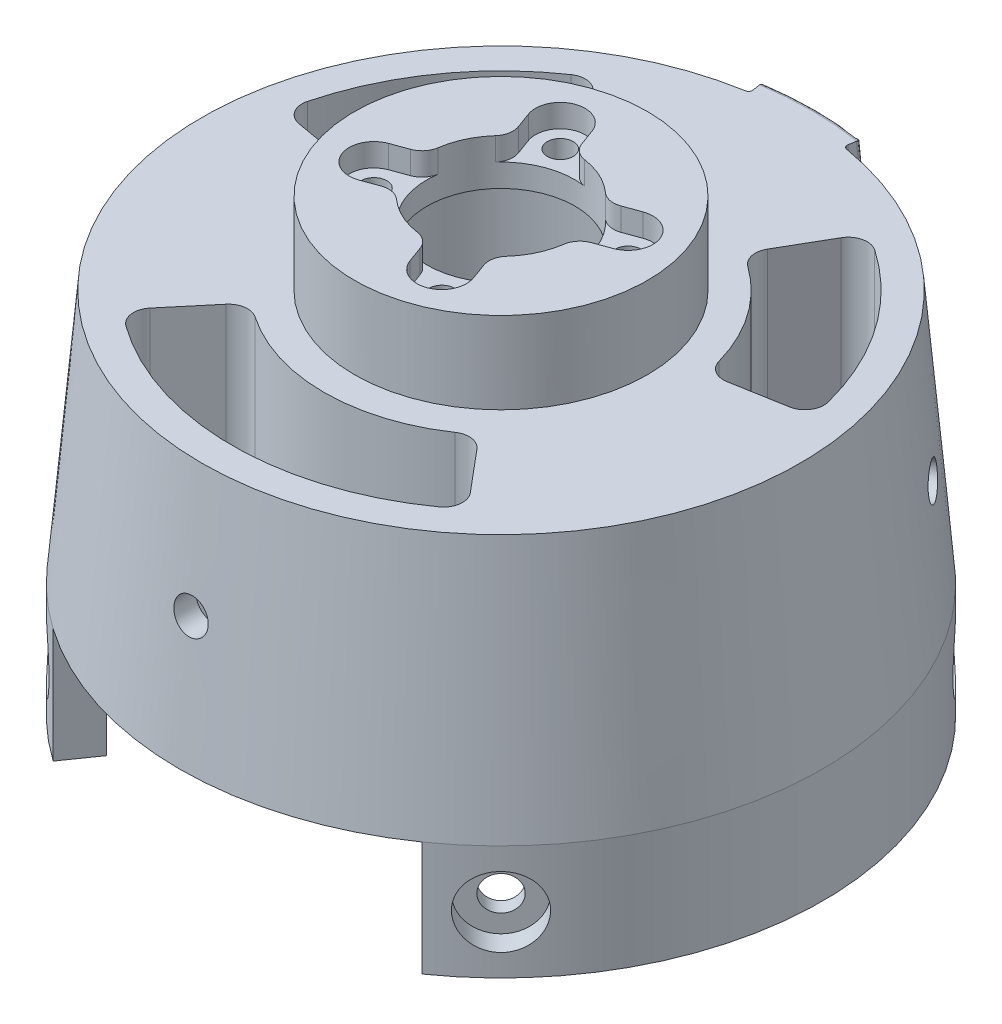
from build123d import *

# Parameters (mm, degrees)
BOSS_EXTRUDE1_DEPTH            = 44
CBORE_FOR_M3_SHCS1_D           = 3.4
CBORE_FOR_M3_SHCS1_CBORE_D     = 6.5
CBORE_FOR_M3_SHCS1_CBORE_DEPTH = 3
CIRPATTERN1_COUNT              = 4
SKETCH4_R                      = 16.2
CUT_EXTRUDE1_DEPTH             = 38
SKETCH5_R                      = 9.7
CUT_EXTRUDE2_DEPTH             = 66.498740446
SKETCH7_R                      = 42.162239665
BOSS_EXTRUDE2_DEPTH            = 44
CUT_EXTRUDE3_DEPTH             = 69.288628024
CUT_EXTRUDE3_DEPTH_BACK        = 69.288628024
SKETCH13_R                     = 35.25
SKETCH13_R_2                   = 19.2
BOSS_EXTRUDE4_DEPTH            = 33.28705169
SKETCH17_R                     = 23.2
SKETCH17_R_2                   = 19.2
BOSS_EXTRUDE5_DEPTH            = 33.28705169
FILLET2_R                      = 2.5
CUT_EXTRUDE5_START             = -10
SKETCH20_R                     = 2.25
CUT_EXTRUDE5_DEPTH             = 109.417716904
CUT_EXTRUDE6_START             = -10
CUT_EXTRUDE6_DEPTH             = 12.5
CIRPATTERN2_COUNT              = 3
CIRPATTERN2_ANGLE              = 250
TEMPORARY_PROBNABLY_DEPTH      = 3
ALSO_PROBABLY_TEMPORARY_R      = 2.5
KEY_1_ANGLE                    = 9
KEY_1_OTHER_WAY_ANGLE          = 9
KEY_2_R                        = 0.5
BOSS_EXTRUDE6_DEPTH            = 15
SKETCH28_R                     = 2.25
CUT_EXTRUDE7_DEPTH             = 116.318379901
CUT_EXTRUDE7_DIRECTION_2_REACH = 117.318
SKETCH29_R                     = 4.6
SKETCH29_R_2                   = 2.25
CUT_EXTRUDE8_DEPTH             = 3
MIRROR2_START                  = 39.162239665
MIRROR2_OUTLINE_R              = 4.6
MIRROR2_DEPTH                  = 3
MIRROR2_START_2                = 37.094063534
MIRROR2_2_OUTLINE_R            = 2.25
MIRROR2_2_DEPTH                = 2.068176131
MIRROR2_3_OUTLINE_R            = 4.6
MIRROR2_3_DEPTH                = 3
MIRROR2_4_OUTLINE_R            = 2.25
MIRROR2_4_DEPTH                = 2.068176131


# Read off the part's stored shape, not the designer's step: Mirror2
with BuildPart() as part:
    # Sketch1 → Boss-Extrude1 (new body)
    with BuildSketch(Plane(origin=(0, 0, 0), x_dir=(1, 0, 0), z_dir=(0, 1, 0))):
        with BuildLine():
            Line((-29.85, 23.917357714), (-29.85, -23.917357714))
            ThreePointArc((-29.85, -23.917357714), (0, -38.25), (29.85, -23.917357714))
            Line((29.85, -23.917357714), (29.85, 23.917357714))
            ThreePointArc((29.85, 23.917357714), (0, 38.25), (-29.85, 23.917357714))
        make_face()
    extrude(amount=BOSS_EXTRUDE1_DEPTH)

    # CBORE for M3 SHCS1 (through all)
    with Locations(Plane(origin=(0, 44, 0), x_dir=(1, 0, 0), z_dir=(0, 1, 0))):
        with Locations((-4.446261863, 12.21600407)):
            cbore_for_m3_shcs1 = CounterBoreHole(CBORE_FOR_M3_SHCS1_D / 2, CBORE_FOR_M3_SHCS1_CBORE_D / 2, CBORE_FOR_M3_SHCS1_CBORE_DEPTH)

    # CirPattern1: CBORE for M3 SHCS1 ×4 about axis
    cirpattern1_axis = Axis((0, 0, 0), (0, 1, 0))
    for i in range(1, CIRPATTERN1_COUNT):
        add(cbore_for_m3_shcs1.rotate(cirpattern1_axis, i * 360 / CIRPATTERN1_COUNT), mode=Mode.SUBTRACT)

    # Sketch4 → Cut-Extrude1 (cut)
    with BuildSketch(Plane.XZ):
        with Locations(Location((0, 0, 0), (0, 0, 270))):
            Circle(SKETCH4_R)
    extrude(amount=-CUT_EXTRUDE1_DEPTH, mode=Mode.SUBTRACT)

    # Sketch5 → Cut-Extrude2 (cut, through all)
    with BuildSketch(Plane(origin=(0, 44, 0), x_dir=(1, 0, 0), z_dir=(0, 1, 0))):
        with Locations(Location((0, 0, 0), (0, 0, 270))):
            Circle(SKETCH5_R)
    extrude(amount=-CUT_EXTRUDE2_DEPTH, mode=Mode.SUBTRACT)

    # Sketch7 → Boss-Extrude2 (add)
    with BuildSketch(Plane.XZ):
        with Locations(Location((0, 0, 0), (0, 0, 270))):
            Circle(SKETCH7_R)
        with BuildLine():
            Line((29.85, 23.917357714), (29.85, -23.917357714))
            ThreePointArc((29.85, -23.917357714), (0, -38.25), (-29.85, -23.917357714))
            Line((-29.85, -23.917357714), (-29.85, 23.917357714))
            ThreePointArc((-29.85, 23.917357714), (0, 38.25), (29.85, 23.917357714))
        make_face(mode=Mode.SUBTRACT)
    extrude(amount=-BOSS_EXTRUDE2_DEPTH)

    # Sketch9 → Cut-Revolve2 (revolve, cut)
    with BuildSketch(Plane(origin=(0, 0, 0), x_dir=(0, 0, -1), z_dir=(1, 0, 0)), mode=Mode.PRIVATE) as cut_revolve2_sk:
        Polygon((-42.162239665, 0), (-38.31273847, 44), (-42.162239665, 44), align=None)
    revolve(cut_revolve2_sk.sketch.rotate(Axis((0, 0, 0), (0, 1, 0)), 180), axis=Axis((0, 0, 0), (0, 1, 0)), mode=Mode.SUBTRACT)

    # Sketch10 → Cut-Revolve3 (revolve, cut)
    with BuildSketch(Plane(origin=(0, 0, 0), x_dir=(0, 0, -1), z_dir=(1, 0, 0)), mode=Mode.PRIVATE) as cut_revolve3_sk:
        Polygon((-19.2, 44), (-19.2, 33.28705169), (-39.25, 33.28705169), (-38.31273847, 44), align=None)
    revolve(cut_revolve3_sk.sketch.rotate(Axis((0, 0, 0), (0, 1, 0)), 180), axis=Axis((0, 0, 0), (0, 1, 0)), mode=Mode.SUBTRACT)

    # Sketch13 → Cut-Extrude3 (cut, two sides: drawn at the far end of the back side and taken through both)
    with BuildSketch(Plane(origin=(0, 33.28705169, 0), x_dir=(1, 0, 0), z_dir=(0, 1, 0)).offset(-CUT_EXTRUDE3_DEPTH_BACK)):
        with Locations(Location((0, 0, 0), (0, 0, 270))):
            Circle(SKETCH13_R)
        with Locations(Location((0, 0, 0), (0, 0, 90))):
            Circle(SKETCH13_R_2, mode=Mode.SUBTRACT)
    extrude(amount=CUT_EXTRUDE3_DEPTH + CUT_EXTRUDE3_DEPTH_BACK, mode=Mode.SUBTRACT)


with BuildPart() as cut_extrude3_piece_1:
    # of the separate pieces the step leaves, piece 1, a body of its own (cut_extrude3_pieces)
    add(part.part.solids().sort_by_distance((0, 0, -42.162239665))[0])



with BuildPart() as cut_extrude3_piece_2:
    # of the separate pieces the step leaves, piece 2, a body of its own (cut_extrude3_pieces)
    add(part.part.solids().sort_by_distance((0, 0, -19.2))[0])


with BuildPart() as cut_extrude3_piece_1_1:
    add(cut_extrude3_piece_1.part)

    add(cut_extrude3_piece_2.part)  # Boss-Extrude4 merges Cut-Extrude3 piece 2
    # Sketch16 → Boss-Extrude4 (add)
    with BuildSketch(Plane.XZ):
        with BuildLine():
            Line((-17.625, -30.527395483), (-9.6, -16.627687753))
            ThreePointArc((-9.6, -16.627687753), (0, -19.2), (9.6, -16.627687753))
            Line((9.6, -16.627687753), (17.625, -30.527395483))
            ThreePointArc((17.625, -30.527395483), (0, -35.25), (-17.625, -30.527395483))
        make_face()
        with BuildLine():
            Line((-34.714473294, -6.121098263), (-18.908308858, -3.334045011))
            ThreePointArc((-18.908308858, -3.334045011), (-18.042098319, 6.566786752), (-12.341522106, 14.708053308))
            Line((-12.341522106, 14.708053308), (-22.658263241, 27.00306662))
            ThreePointArc((-22.658263241, 27.00306662), (-33.124164883, 12.056210052), (-34.714473294, -6.121098263))
        make_face()
        with BuildLine():
            Line((22.658263241, 27.00306662), (12.341522106, 14.708053308))
            ThreePointArc((12.341522106, 14.708053308), (18.042098319, 6.566786752), (18.908308858, -3.334045011))
            Line((18.908308858, -3.334045011), (34.714473294, -6.121098263))
            ThreePointArc((34.714473294, -6.121098263), (33.124164883, 12.056210052), (22.658263241, 27.00306662))
        make_face()
    extrude(amount=-BOSS_EXTRUDE4_DEPTH)

    # Sketch17 → Boss-Extrude5 (add)
    with BuildSketch(Plane(origin=(0, 33.28705169, 0), x_dir=(1, 0, 0), z_dir=(0, 1, 0))):
        Circle(SKETCH17_R)
        with Locations(Location((0, 0, 0), (0, 0, 90))):
            Circle(SKETCH17_R_2, mode=Mode.SUBTRACT)
    extrude(amount=-BOSS_EXTRUDE5_DEPTH)

    # Fillet2
    fillet2_edges = [cut_extrude3_piece_1_1.edges().sort_by_distance(p)[0] for p in [
        (-17.625, 16.643525845, -30.527395483),
        (17.625, 16.643525845, -30.527395483),
        (34.714473294, 16.643525845, -6.121098263),
        (22.658263241, 16.643525845, 27.00306662),
        (-22.658263241, 16.643525845, 27.00306662),
        (-34.714473294, 16.643525845, -6.121098263),
        (-14.912672545, 16.643525845, 17.77223108),
        (11.6, 16.643525845, -20.091789368),
        (22.84753987, 16.643525845, -4.028637722),
        (14.912672545, 16.643525845, 17.77223108),
        (-11.6, 16.643525845, -20.091789368),
        (-22.84753987, 16.643525845, -4.028637722),
    ]]
    fillet(fillet2_edges, radius=FILLET2_R)

    # Sketch20 → Cut-Extrude5 (cut)
    with BuildSketch(Plane(origin=(-28.875109561, 16.643525845, -20.218569381), x_dir=(-0.5735764363510477, 0, 0.8191520442889908), z_dir=(-0.8191520442889908, 0, -0.5735764363510477)).offset(CUT_EXTRUDE5_START)):
        with Locations(Location((0, 0, 0), (0, 0, 180))):
            Circle(SKETCH20_R)
    cut_extrude5 = extrude(amount=CUT_EXTRUDE5_DEPTH, mode=Mode.SUBTRACT)

    # Sketch21 → Cut-Extrude6 (cut)
    with BuildSketch(Plane(origin=(-28.875109561, 16.643525845, -20.218569381), x_dir=(-0.5735764363510477, 0, 0.8191520442889908), z_dir=(-0.8191520442889908, 0, -0.5735764363510477)).offset(CUT_EXTRUDE6_START)):
        Polygon((4.041451884, 0), (2.020725942, 3.5), (-2.020725942, 3.5), (-4.041451884, 0), (-2.020725942, -3.5), (2.020725942, -3.5), align=None)
    cut_extrude6 = extrude(amount=CUT_EXTRUDE6_DEPTH, mode=Mode.SUBTRACT)

    # CirPattern2: Cut-Extrude5, Cut-Extrude6 ×3 about axis
    cirpattern2_axis = Axis((0, 0, 0), (0, 1, 0))
    add([cut_extrude5.rotate(cirpattern2_axis, i * CIRPATTERN2_ANGLE / (CIRPATTERN2_COUNT - 1)) for i in range(1, CIRPATTERN2_COUNT)], mode=Mode.SUBTRACT)
    add([cut_extrude6.rotate(cirpattern2_axis, i * CIRPATTERN2_ANGLE / (CIRPATTERN2_COUNT - 1)) for i in range(1, CIRPATTERN2_COUNT)], mode=Mode.SUBTRACT)

    # Sketch22 → temporary_probnably (cut)
    with BuildSketch(Plane(origin=(0, 44, 0), x_dir=(1, 0, 0), z_dir=(0, 1, 0))):
        with BuildLine():
            Line((-11.104438604, -7.500262881), (-1.942435552, -4.165566483))
            Line((-1.942435552, -4.165566483), (1.392260846, -13.327569536))
            ThreePointArc((1.392260846, -13.327569536), (5.557827329, -15.270005088), (7.500262881, -11.104438604))
            Line((7.500262881, -11.104438604), (4.165566483, -1.942435552))
            Line((4.165566483, -1.942435552), (13.327569536, 1.392260846))
            ThreePointArc((13.327569536, 1.392260846), (15.270005088, 5.557827329), (11.104438604, 7.500262881))
            Line((11.104438604, 7.500262881), (1.942435552, 4.165566483))
            Line((1.942435552, 4.165566483), (-1.392260846, 13.327569536))
            ThreePointArc((-1.392260846, 13.327569536), (-5.557827329, 15.270005088), (-7.500262881, 11.104438604))
            Line((-7.500262881, 11.104438604), (-4.165566483, 1.942435552))
            Line((-4.165566483, 1.942435552), (-13.327569536, -1.392260846))
            ThreePointArc((-13.327569536, -1.392260846), (-15.270005088, -5.557827329), (-11.104438604, -7.500262881))
        make_face()
    extrude(amount=-TEMPORARY_PROBNABLY_DEPTH, mode=Mode.SUBTRACT)

    # also_probably_temporary
    # the kernel refuses this fillet: 2.5 mm, written as the material it takes off along each edge
    with BuildSketch(Plane(origin=(-9.699733991, 41, 0.071836692), x_dir=(0.06710224820199669, 0, -0.9977461041197995), z_dir=(0, 1, 0)), Plane(origin=(-0.071836692, 41, -9.699733991), x_dir=(0.9977461041198002, 0, 0.06710224820198499), z_dir=(0, 1, 0)), Plane(origin=(9.699733991, 41, -0.071836692), x_dir=(-0.06710224820198839, 0, 0.9977461041198), z_dir=(0, 1, 0)), Plane(origin=(0.071836692, 41, 9.699733991), x_dir=(-0.997746104119798, 0, -0.06710224820201754), z_dir=(0, 1, 0))) as also_probably_temporary_piece_1:
        with BuildLine():
            CenterArc((1.631321377, 2.493054484), ALSO_PROBABLY_TEMPORARY_R, 203.847566724, 61.880539035)
            Line((-0.65523945, 1.482292601), (0, 0))
            ThreePointArc((0, 0), (0.722548738, 0.026948603), (1.445097475, 0))
        make_face()
    extrude(amount=7.051643257, mode=Mode.SUBTRACT)
    with BuildSketch(Plane(origin=(-7.476603059, 41, 6.179838727), x_dir=(0.6927421376971379, 0, 0.7211853649782417), z_dir=(0, 1, 0)), Plane(origin=(-6.179838727, 41, -7.476603059), x_dir=(-0.7211853649782275, 0, 0.6927421376971526), z_dir=(0, 1, 0)), Plane(origin=(7.476603059, 41, -6.179838727), x_dir=(-0.6927421376971437, 0, -0.7211853649782362), z_dir=(0, 1, 0)), Plane(origin=(6.179838727, 41, 7.476603059), x_dir=(0.7211853649782349, 0, -0.692742137697145), z_dir=(0, 1, 0))) as also_probably_temporary_piece_2:
        with BuildLine():
            CenterArc((1.631321377, -2.493054484), ALSO_PROBABLY_TEMPORARY_R, 94.271894241, 61.880539035)
            Line((-0.65523945, -1.482292601), (0, 0))
            ThreePointArc((0, 0), (0.722548738, -0.026948603), (1.445097475, 0))
        make_face()
    extrude(amount=7.051643257, mode=Mode.SUBTRACT)

    # Sketch24 → key_1 (revolve)
    with BuildSketch(Plane(origin=(0, 0, 0), x_dir=(0, 0, -1), z_dir=(1, 0, 0))):
        Polygon((42.162239665, 0), (44.162239665, 0), (41.25, 33.28705169), (39.25, 33.28705169), align=None)
    revolve(axis=Axis((0, 33.28705169, 0), (0, -1, 0)), revolution_arc=KEY_1_ANGLE)

    # Sketch24 → key_1 other way (revolve)
    with BuildSketch(Plane(origin=(0, 0, 0), x_dir=(0, 0, -1), z_dir=(1, 0, 0))):
        Polygon((42.162239665, 0), (44.162239665, 0), (41.25, 33.28705169), (39.25, 33.28705169), align=None)
    revolve(axis=Axis((0, 33.28705169, 0), (0, 1, 0)), revolution_arc=KEY_1_OTHER_WAY_ANGLE)

    # key_2
    key_2_edges = [cut_extrude3_piece_1_1.edges().sort_by_distance(p)[0] for p in [
        (-6.36784008, 16.643525845, -40.204959949),
        (0, 0, -44.162239665),
        (-6.68070901, 16.643525845, -42.180336631),
        (0, 33.28705169, -41.25),
        (6.36784008, 16.643525845, -40.204959949),
        (6.68070901, 16.643525845, -42.180336631),
    ]]
    fillet(key_2_edges, radius=KEY_2_R)

    # Sketch25 → Boss-Extrude6 (add)
    with BuildSketch(Plane.XZ):
        with BuildLine():
            Line((-21.315384994, 30.441524592), (-24.183267176, 34.537284813))
            ThreePointArc((-24.183267176, 34.537284813), (-42.162239665, 0), (-24.183267176, -34.537284813))
            Line((-24.183267176, -34.537284813), (-21.315384994, -30.441524592))
            ThreePointArc((-21.315384994, -30.441524592), (-37.162239665, 0), (-21.315384994, 30.441524592))
        make_face()
        with BuildLine():
            Line((21.315384994, 30.441524592), (24.183267176, 34.537284813))
            ThreePointArc((24.183267176, 34.537284813), (42.162239665, 0), (24.183267176, -34.537284813))
            Line((24.183267176, -34.537284813), (21.315384994, -30.441524592))
            ThreePointArc((21.315384994, -30.441524592), (37.162239665, 0), (21.315384994, 30.441524592))
        make_face()
    extrude(amount=BOSS_EXTRUDE6_DEPTH)

    # Sketch28 → Cut-Extrude7 (cut)
    with BuildSketch(Plane(origin=(-29.813205577, -7.5, 29.813205577), x_dir=(0.7071067811865488, 0, 0.7071067811865462), z_dir=(-0.7071067811865462, 0, 0.7071067811865488))):
        with Locations(Location((0, 0, 0), (0, 0, 180))):
            Circle(SKETCH28_R)
    cut_extrude7 = extrude(amount=CUT_EXTRUDE7_DEPTH, mode=Mode.SUBTRACT)

    # Sketch28 → Cut-Extrude7 direction 2 (cut, up to next)
    with BuildSketch(Plane(origin=(-29.813205577, -7.5, 29.813205577), x_dir=(0.7071067811865488, 0, 0.7071067811865462), z_dir=(-0.7071067811865462, 0, 0.7071067811865488)), mode=Mode.PRIVATE) as cut_extrude7_direction_2_sk1:
        with Locations(Location((0, 0, 0), (0, 0, 180))):
            Circle(SKETCH28_R)
    cut_extrude7_direction_2_tool1 = extrude(cut_extrude7_direction_2_sk1.sketch, amount=-CUT_EXTRUDE7_DIRECTION_2_REACH, mode=Mode.PRIVATE) & cut_extrude3_piece_1_1.part
    cut_extrude7_direction_2 = cut_extrude7_direction_2_tool1.solids().sort_by_distance((-29.813206, -7.5, 29.813206))[0]
    add(cut_extrude7_direction_2, mode=Mode.SUBTRACT)

    # Sketch29 → Cut-Extrude8 (cut)
    with BuildSketch(Plane(origin=(-29.813205577, -7.5, 29.813205577), x_dir=(0.7071067811865488, 0, 0.7071067811865462), z_dir=(-0.7071067811865462, 0, 0.7071067811865488))):
        Circle(SKETCH29_R)
        with Locations(Location((0, 0, 0), (0, 0, 180))):
            Circle(SKETCH29_R_2, mode=Mode.SUBTRACT)
    cut_extrude8 = extrude(amount=-CUT_EXTRUDE8_DEPTH, mode=Mode.SUBTRACT)

    # Mirror1: Cut-Extrude7, Cut-Extrude7 direction 2, Cut-Extrude8 across plane
    add(cut_extrude7.mirror(Plane.XY), mode=Mode.SUBTRACT)
    add(cut_extrude7_direction_2.mirror(Plane.XY), mode=Mode.SUBTRACT)
    add(cut_extrude8.mirror(Plane.XY), mode=Mode.SUBTRACT)

    # Mirror2 outline → Mirror2 (cut)
    with BuildSketch(Plane(origin=(0, 0, 0), x_dir=(0.707106781186549, 0, -0.707106781186546), z_dir=(0.707106781186546, 0, 0.707106781186549)).offset(MIRROR2_START)):
        with Locations((0, -7.5)):
            Circle(MIRROR2_OUTLINE_R)
    extrude(amount=MIRROR2_DEPTH, mode=Mode.SUBTRACT)

    # Mirror2 2 outline → Mirror2 2 (cut)
    with BuildSketch(Plane(origin=(0, 0, 0), x_dir=(0.707106781186549, 0, -0.707106781186546), z_dir=(0.707106781186546, 0, 0.707106781186549)).offset(MIRROR2_START_2)):
        with Locations((0, -7.5)):
            Circle(MIRROR2_2_OUTLINE_R)
    extrude(amount=MIRROR2_2_DEPTH, mode=Mode.SUBTRACT)

    # Mirror2 3 outline → Mirror2 3 (cut)
    with BuildSketch(Plane(origin=(0, 0, 0), x_dir=(0.707106781186549, 0, 0.707106781186546), z_dir=(0.707106781186546, 0, -0.707106781186549)).offset(MIRROR2_START)):
        with Locations((0, 7.5)):
            Circle(MIRROR2_3_OUTLINE_R)
    extrude(amount=MIRROR2_3_DEPTH, mode=Mode.SUBTRACT)

    # Mirror2 4 outline → Mirror2 4 (cut)
    with BuildSketch(Plane(origin=(0, 0, 0), x_dir=(0.707106781186549, 0, 0.707106781186546), z_dir=(0.707106781186546, 0, -0.707106781186549)).offset(MIRROR2_START_2)):
        with Locations((0, 7.5)):
            Circle(MIRROR2_4_OUTLINE_R)
    extrude(amount=MIRROR2_4_DEPTH, mode=Mode.SUBTRACT)


solid = cut_extrude3_piece_1_1.part
